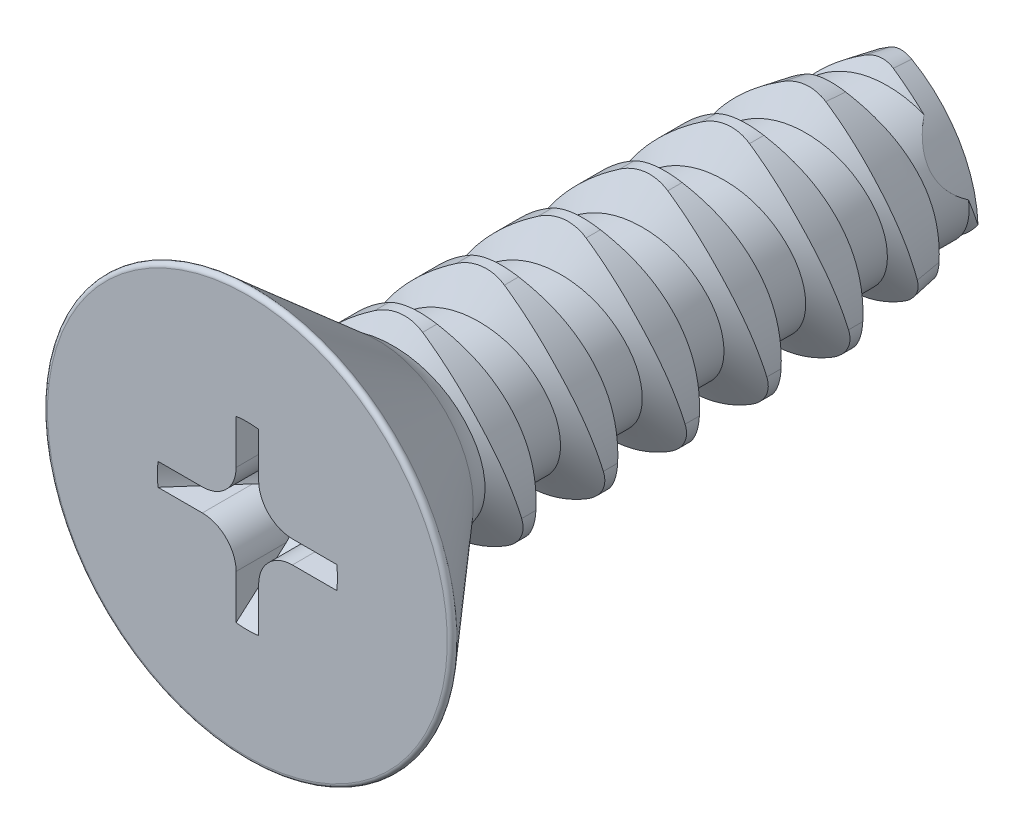
from build123d import *

# Parameters (mm, degrees)
CUT_EXTRUDE1_START       = -6.35
CUT_EXTRUDE1_2_OUTLINE_R = 2.0828
CUT_EXTRUDE1_2_DEPTH     = 2.38125
CUT_EXTRUDE1_START_2     = -5.145992375
CUT_EXTRUDE1_3_DEPTH     = 8.955992375
CUT_EXTRUDE2_REACH       = 15.881
CIRPATTERN2_COUNT        = 4
CUT_SWEEP5_PITCH         = 1.5875
CUT_SWEEP5_TO            = 10.16


with BuildPart() as part:
    # Sketch3 → Revolve1 (revolve)
    with BuildSketch(Plane(origin=(0, 0, 0), x_dir=(0, 0, -1), z_dir=(1, 0, 0)), mode=Mode.PRIVATE) as revolve1_sk:
        with BuildLine():
            Line((-6.35, 0), (-6.35, 3.883152))
            ThreePointArc((-6.35, 3.883152), (-6.30361561, 3.955264611), (-6.218760634, 3.942961225))
            Line((-6.218760634, 3.942961225), (-3.81, 1.849057551))
            Line((-3.81, 1.849057551), (-3.81, 2.0828))
            Line((-3.81, 2.0828), (6.35, 2.0828))
            Line((6.35, 2.0828), (6.35, 0))
            Line((6.35, 0), (-6.35, 0))
        make_face()
    revolve(revolve1_sk.sketch.rotate(Axis((0, 0, 6.35), (0, 0, -1)), 180), axis=Axis((0, 0, 6.35), (0, 0, -1)))

    # Cut-Extrude1: read off the stored shape, not the designer's step
    # Cut-Extrude1 outline → Cut-Extrude1 (revolve, cut)
    with BuildSketch(Plane(origin=(-1.082254627, -0.62484, 0), x_dir=(1, 0, 0), z_dir=(0, -1, 0))):
        Polygon((2.997629253, -3.96875), (2.57775063, -6.35), (2.997629253, -6.35), align=None)
    revolve(axis=Axis((-1.082254627, -0.62484, 0), (0, 0, 1)), mode=Mode.SUBTRACT)

    # Cut-Extrude1 2 outline → Cut-Extrude1 2 (cut)
    with BuildSketch(Plane.XY.offset(CUT_EXTRUDE1_START)):
        Circle(CUT_EXTRUDE1_2_OUTLINE_R)
    extrude(amount=CUT_EXTRUDE1_2_DEPTH, mode=Mode.SUBTRACT)

    # Cut-Extrude1 3 outline → Cut-Extrude1 3 (cut)
    with BuildSketch(Plane.XY.offset(CUT_EXTRUDE1_START_2)):
        with BuildLine():
            ThreePointArc((1.803757713, -1.041399997), (1.80375771, 1.041400001), (0, 2.0828))
            ThreePointArc((0, 2.0828), (0.215627323, 2.054412124), (0.41656, 1.971183084))
            ThreePointArc((0.41656, 1.971183084), (1.513768458, 0.873974627), (1.915374627, -0.62484))
            ThreePointArc((1.915374627, -0.62484), (1.886986752, -0.840467321), (1.803757713, -1.041399997))
        make_face()
        with BuildLine():
            ThreePointArc((-1.803757715, -1.041399994), (-2e-09, -2.0828), (1.803757713, -1.041399997))
            ThreePointArc((1.803757713, -1.041399997), (1.671359429, -1.2139448), (1.498814627, -1.346343084))
            ThreePointArc((1.498814627, -1.346343084), (0, -1.747949253), (-1.498814627, -1.346343084))
            ThreePointArc((-1.498814627, -1.346343084), (-1.671359431, -1.213944799), (-1.803757715, -1.041399994))
        make_face()
        with BuildLine():
            ThreePointArc((0, 2.0828), (-1.803757709, 1.041400003), (-1.803757715, -1.041399994))
            ThreePointArc((-1.803757715, -1.041399994), (-1.886986752, -0.840467319), (-1.915374627, -0.62484))
            ThreePointArc((-1.915374627, -0.62484), (-1.513768458, 0.873974627), (-0.41656, 1.971183084))
            ThreePointArc((-0.41656, 1.971183084), (-0.215627323, 2.054412124), (0, 2.0828))
        make_face()
    extrude(amount=CUT_EXTRUDE1_3_DEPTH, mode=Mode.SUBTRACT)

    # Cut-Extrude1 4: loft between two sections, ruled curve by curve
    cut_extrude1_4_from = [
        Edge.make_three_point_arc((-1.288875315, -0.982717531, -6.35), (0, -1.32807063, -6.35), (1.288875315, -0.982717531, -6.35)),
        Edge.make_three_point_arc((-1.495496004, -0.62484, -6.35), (-1.440132157, -0.831460689, -6.35), (-1.288875315, -0.982717531, -6.35)),
        Edge.make_three_point_arc((-0.206620689, 1.607557531, -6.35), (-1.150142904, 0.664035315, -6.35), (-1.495496004, -0.62484, -6.35)),
        Edge.make_three_point_arc((0.206620689, 1.607557531, -6.35), (0, 1.662921377, -6.35), (-0.206620689, 1.607557531, -6.35)),
        Edge.make_three_point_arc((1.495496004, -0.62484, -6.35), (1.150142904, 0.664035315, -6.35), (0.206620689, 1.607557531, -6.35)),
        Edge.make_three_point_arc((1.288875315, -0.982717531, -6.35), (1.440132157, -0.831460689, -6.35), (1.495496004, -0.62484, -6.35)),
    ]
    cut_extrude1_4_to = [
        Edge.make_three_point_arc((-1.498814627, -1.346343084, -3.96875), (0, -1.747949253, -3.96875), (1.498814627, -1.346343084, -3.96875)),
        Edge.make_three_point_arc((-1.915374627, -0.62484, -3.96875), (-1.803757711, -1.0414, -3.96875), (-1.498814627, -1.346343084, -3.96875)),
        Edge.make_three_point_arc((-0.41656, 1.971183084, -3.96875), (-1.513768458, 0.873974627, -3.96875), (-1.915374627, -0.62484, -3.96875)),
        Edge.make_three_point_arc((0.41656, 1.971183084, -3.96875), (0, 2.0828, -3.96875), (-0.41656, 1.971183084, -3.96875)),
        Edge.make_three_point_arc((1.915374627, -0.62484, -3.96875), (1.513768458, 0.873974627, -3.96875), (0.41656, 1.971183084, -3.96875)),
        Edge.make_three_point_arc((1.498814627, -1.346343084, -3.96875), (1.803757711, -1.0414, -3.96875), (1.915374627, -0.62484, -3.96875)),
    ]
    cut_extrude1_4 = Solid(Shell([*[Face.make_surface_from_curves(cut_extrude1_4_from[k], cut_extrude1_4_to[k]) for k in range(6)], Face(Wire(cut_extrude1_4_from)), Face(Wire(cut_extrude1_4_to))]))
    add(cut_extrude1_4)

    # Cut-Extrude2: up to this cone (the profile starts inside it)
    cut_extrude2_end = Plane(origin=(0, 0, 6.35), z_dir=(0, 0, 1)).offset(-2.013143713) * Cone(1e-06, 17.511037843, 20.144143713, align=(Align.CENTER, Align.CENTER, Align.MIN), mode=Mode.PRIVATE)
    # Cut-Extrude2 Sketch → Cut-Extrude2 (cut, up to the surface)
    with BuildSketch(Plane.XY.offset(6.35), mode=Mode.PRIVATE) as cut_extrude2_sk1:
        with BuildLine():
            Line((0, 1.75), (0, 0))
            Line((0, 0), (1.75, 0))
            ThreePointArc((1.75, 0), (1.746565204, 0.109590097), (1.736274298, 0.21875))
            Line((1.736274298, 0.21875), (0.875, 0.21875))
            ThreePointArc((0.875, 0.21875), (0.410961175, 0.410961175), (0.21875, 0.875))
            Line((0.21875, 0.875), (0.21875, 1.736274298))
            ThreePointArc((0.21875, 1.736274298), (0.109590097, 1.746565204), (0, 1.75))
        make_face()
    cut_extrude2_tool1 = extrude(cut_extrude2_sk1.sketch, amount=-CUT_EXTRUDE2_REACH, mode=Mode.PRIVATE) & cut_extrude2_end
    cut_extrude2 = cut_extrude2_tool1.solids().sort_by_distance((0.024749, 0.875, 6.35))[0]
    add(cut_extrude2, mode=Mode.SUBTRACT)

    # CirPattern2: Cut-Extrude2 ×4 about axis
    cirpattern2_axis = Axis((0, 0, 0), (0, 0, 1))
    for i in range(1, CIRPATTERN2_COUNT):
        add(cut_extrude2.rotate(cirpattern2_axis, i * 360 / CIRPATTERN2_COUNT), mode=Mode.SUBTRACT)


with BuildPart() as body_2:
    # Split1: read off the stored shape, not the designer's step
    # Split1: the piece on the far side of the plane
    add(part.part)
    split(bisect_by=Plane.XY.offset(3.81), keep=Keep.BOTTOM)

    # Cut-Sweep5: arcs per turn and ends read off the stored shape
    # Cut-Sweep5: the profile of Sketch8 screwed along a right-hand helix through 9 turns, 8 arcs to a turn; built about Z, then put on its axis
    cut_sweep5_z = Axis((0, 0, 0), (0, 0, 1))
    cut_sweep5_corners = [(2.168725958, 0, 0.049609375), (2.168725958, 0, -1.438671875), (1.460901916, 0, -1.030009474), (1.460901916, 0, -0.359053026)]
    with BuildLine(mode=Mode.PRIVATE) as cut_sweep5_profile:
        Line(cut_sweep5_corners[0], cut_sweep5_corners[1])
        Line(cut_sweep5_corners[1], cut_sweep5_corners[2])
        Line(cut_sweep5_corners[2], cut_sweep5_corners[3])
        Line(cut_sweep5_corners[3], cut_sweep5_corners[0])
    cut_sweep5_cap = Face(cut_sweep5_profile.wire())
    cut_sweep5_turn_angles = [0, 22.5, 45, 67.5, 90, 112.5, 135, 157.5, 180, 202.5, 225, 247.5, 270, 292.5, 315, 337.5, 360]
    cut_sweep5_turn_weights = [1, 0.9238795325112867, 1, 0.9238795325112867, 1, 0.9238795325112867, 1, 0.9238795325112867, 1, 0.9238795325112867, 1, 0.9238795325112867, 1, 0.9238795325112867, 1, 0.9238795325112867, 1]
    cut_sweep5_turn_rails = [Edge.make_bspline([Vector(p[0], p[1], 0).rotate(cut_sweep5_z, cut_sweep5_turn_angles[k]) / cut_sweep5_turn_weights[k] + Vector(0, 0, p[2] + CUT_SWEEP5_PITCH * cut_sweep5_turn_angles[k] / 360) for k in range(17)], [0, 0, 0, 1, 1, 2, 2, 3, 3, 4, 4, 5, 5, 6, 6, 7, 7, 8, 8, 8], 2, cut_sweep5_turn_weights) for p in cut_sweep5_corners]
    cut_sweep5_turn_sides = [Face.make_surface_from_curves(cut_sweep5_turn_rails[p[0]], cut_sweep5_turn_rails[p[1]]) for p in [(0, 1), (1, 2), (2, 3), (3, 0)]]
    cut_sweep5 = Plane(origin=(0, 0, -6.35), x_dir=(0, 1, 0), z_dir=(0, 0, 1)) * split(Solid(Shell([*[p.moved(Location((0, 0, CUT_SWEEP5_PITCH * i))) for i in range(9) for p in cut_sweep5_turn_sides], cut_sweep5_cap, cut_sweep5_cap.rotate(cut_sweep5_z, 3240).moved(Location((0, 0, CUT_SWEEP5_PITCH * 3240 / 360)))])), bisect_by=Plane.XY.offset(CUT_SWEEP5_TO), keep=Keep.BOTTOM, mode=Mode.PRIVATE)
    add(cut_sweep5, mode=Mode.SUBTRACT)


with BuildPart() as part_1:
    add(part.part)

    # Split1
    split(bisect_by=Plane.XY.offset(3.81), keep=Keep.TOP)

    add(body_2.part)  # Revolve2 merges body 2
    # Sketch9 → Revolve2 (revolve)
    with BuildSketch(Plane(origin=(0, 0, 0), x_dir=(0, 0, -1), z_dir=(1, 0, 0)), mode=Mode.PRIVATE) as revolve2_sk:
        with BuildLine():
            Line((-3.81, 1.849057551), (-3.81, 0))
            Line((-3.81, 0), (-2.771830596, 0))
            Line((-2.771830596, 0), (-2.771830596, 1.460901916))
            ThreePointArc((-2.771830596, 1.460901916), (-3.326010284, 1.561113928), (-3.81, 1.849057551))
        make_face()
    revolve(revolve2_sk.sketch.rotate(Axis((0, 0, 3.81), (0, 0, -1)), 180), axis=Axis((0, 0, 3.81), (0, 0, -1)))


solid = part_1.part
